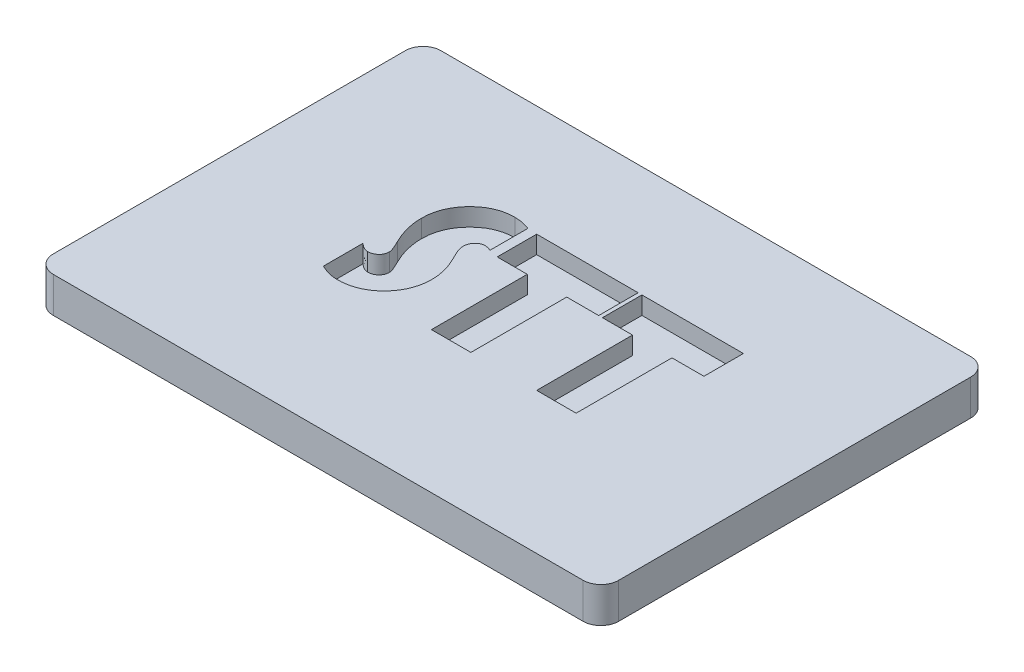
from build123d import *

# Parameters (mm, degrees)
SKETCH1_W           = 31.8
SKETCH1_H           = 21.8
BOSS_EXTRUDE1_DEPTH = 2
FILLET1_R           = 1
CUT_EXTRUDE1_DEPTH  = 1


with BuildPart() as part:
    # Sketch1 → Boss-Extrude1 (new body)
    with BuildSketch(Plane(origin=(0, 0, 0), x_dir=(1, 0, 0), z_dir=(0, 1, 0))):
        with Locations((15.9, 10.9)):
            Rectangle(SKETCH1_W, SKETCH1_H)
    extrude(amount=BOSS_EXTRUDE1_DEPTH)

    # Fillet1
    fillet1_edges = [part.edges().sort_by_distance(p)[0] for p in [
        (0, 1, -21.8),
        (31.8, 1, -21.8),
        (31.8, 1, 0),
        (0, 1, 0),
    ]]
    fillet(fillet1_edges, radius=FILLET1_R)

    # Sketch2 → Cut-Extrude1 (cut)
    with BuildSketch(Plane(origin=(0, 2, 0), x_dir=(1, 0, 0), z_dir=(0, 1, 0))):
        with BuildLine():
            Line((12.103669389, 15.588212785), (12.103669389, 13.462510817))
            add(Edge.make_bspline(
                [(12.103669389, 13.462510817), (12.067478164, 13.475119517), (11.999485838, 13.498807438), (11.902825223, 13.524429421), (11.819220361, 13.543594224), (11.767361344, 13.545755856), (11.743604875, 13.546746093)],
                knots=[0, 0, 0, 0, 1.237925225, 2.325685716, 3.233001373, 4, 4, 4, 4], degree=3))
            add(Edge.make_bspline(
                [(11.743604875, 13.546746093), (11.704213128, 13.544747386), (11.626409193, 13.540799674), (11.515264032, 13.5023983), (11.413284829, 13.440703726), (11.322657643, 13.357416549), (11.246986203, 13.257257504), (11.191005288, 13.144920434), (11.159374222, 13.021555746), (11.154701285, 12.936352871), (11.15230627, 12.892683949)],
                knots=[0, 0, 0, 0, 0.963368211, 1.902780206, 2.847611186, 3.870376157, 4.902016381, 5.910508887, 6.929075774, 8, 8, 8, 8], degree=3))
            add(Edge.make_bspline(
                [(11.15230627, 12.892683949), (11.15494117, 12.85121414), (11.160596524, 12.762206396), (11.196833346, 12.622832478), (11.251552483, 12.467862827), (11.302052911, 12.362588312), (11.329035183, 12.306340361)],
                knots=[0, 0, 0, 0, 0.806548219, 1.731115713, 2.787739919, 4, 4, 4, 4], degree=3))
            Line((11.329035183, 12.306340361), (11.480989014, 12.002432698))
            add(Edge.make_bspline(
                [(11.480989014, 12.002432698), (11.513536687, 11.934444257), (11.577742801, 11.800324882), (11.662079456, 11.597114589), (11.733408397, 11.395368804), (11.791392984, 11.195204542), (11.836455238, 10.996679116), (11.867058786, 10.800156819), (11.888566792, 10.605590355), (11.891027745, 10.476344982), (11.892255362, 10.411872484)],
                knots=[0, 0, 0, 0, 1.091274604, 2.152734579, 3.183918567, 4.18803247, 5.168547751, 6.129191744, 7.06676982, 8, 8, 8, 8], degree=3))
            add(Edge.make_bspline(
                [(11.892255362, 10.411872484), (11.890225491, 10.319811484), (11.886234258, 10.138796556), (11.848968389, 9.87257458), (11.7871313, 9.618136518), (11.705779366, 9.372853513), (11.594665045, 9.140936753), (11.462303763, 8.918016389), (11.304584517, 8.706541227), (11.12575761, 8.508278481), (10.930218444, 8.327288301), (10.721786317, 8.167515195), (10.501561069, 8.03381528), (10.271033103, 7.923175105), (10.030138854, 7.837614737), (9.778422655, 7.776154585), (9.516075498, 7.738855663), (9.337242235, 7.734881747), (9.246276689, 7.732860369)],
                knots=[0, 0, 0, 0, 1.053025029, 2.070510305, 3.068320851, 4.046527558, 5.021625387, 6.004830255, 7.00906403, 8.035056499, 9.055988148, 10.053937905, 11.035000932, 11.998716703, 12.975116181, 13.954559623, 14.959563797, 16, 16, 16, 16], degree=3))
            add(Edge.make_bspline(
                [(9.246276689, 7.732860369), (9.15737082, 7.735867692), (8.979182335, 7.741895083), (8.713145876, 7.796831496), (8.448152575, 7.881331106), (8.278615751, 7.963601867), (8.192509902, 8.005386262)],
                knots=[0, 0, 0, 0, 0.970033745, 1.944178097, 2.955871129, 4, 4, 4, 4], degree=3))
            Line((8.192509902, 8.005386262), (8.192509902, 10.225233539))
            add(Edge.make_bspline(
                [(8.192509902, 10.225233539), (8.239360411, 10.184176873), (8.326844527, 10.107511621), (8.464042527, 10.021318896), (8.593353454, 9.963617797), (8.679277497, 9.956180114), (8.719393295, 9.952707646)],
                knots=[0, 0, 0, 0, 1.232278927, 2.301038614, 3.206797186, 4, 4, 4, 4], degree=3))
            add(Edge.make_bspline(
                [(8.719393295, 9.952707646), (8.763072091, 9.9550561), (8.847761486, 9.959609549), (8.970006261, 9.99147408), (9.079760325, 10.046708338), (9.176034752, 10.12153861), (9.256059824, 10.212425828), (9.314481099, 10.317019556), (9.348992402, 10.433983951), (9.353137752, 10.515141043), (9.355287046, 10.557219627)],
                knots=[0, 0, 0, 0, 1.069499973, 2.073667633, 3.068739384, 4.058680921, 5.043096131, 6.014962219, 6.970791368, 8, 8, 8, 8], degree=3))
            add(Edge.make_bspline(
                [(9.355287046, 10.557219627), (9.353993911, 10.5732392), (9.35102175, 10.61005883), (9.336318039, 10.671177476), (9.315251067, 10.745339397), (9.283376584, 10.831283487), (9.24041635, 10.92869113), (9.194107325, 11.041092621), (9.135695208, 11.164785236), (9.092335481, 11.250480108), (9.069547776, 11.295517047)],
                knots=[0, 0, 0, 0, 0.484238432, 1.112981033, 1.890960445, 2.8104886, 3.874776843, 5.102625601, 6.477284912, 8, 8, 8, 8], degree=3))
            add(Edge.make_bspline(
                [(9.069547776, 11.295517047), (9.033489259, 11.370577397), (8.962137311, 11.519105476), (8.870718297, 11.74559598), (8.789324611, 11.970644468), (8.727749512, 12.197526783), (8.677743114, 12.424035557), (8.641289959, 12.650053805), (8.618764973, 12.876254743), (8.616481513, 13.026968628), (8.615337954, 13.102446303)],
                knots=[0, 0, 0, 0, 1.062729974, 2.102911069, 3.116516653, 4.11571732, 5.10138035, 6.076564273, 7.036741329, 8, 8, 8, 8], degree=3))
            add(Edge.make_bspline(
                [(8.615337954, 13.102446303), (8.617374488, 13.191763492), (8.621402125, 13.368405389), (8.658949616, 13.627812323), (8.718714197, 13.877686492), (8.800892673, 14.118407163), (8.909835089, 14.348957713), (9.039927599, 14.570795718), (9.195510347, 14.78216903), (9.372301671, 14.981267002), (9.564876472, 15.164537181), (9.768891596, 15.326311523), (9.983003732, 15.462709256), (10.206808123, 15.57362623), (10.439734455, 15.660677849), (10.682504581, 15.720848377), (10.934047885, 15.761052579), (11.105351026, 15.764732921), (11.1919464, 15.76659337)],
                knots=[0, 0, 0, 0, 1.04134106, 2.059451963, 3.050112589, 4.035116009, 5.020558971, 6.01953182, 7.030426816, 8.076805362, 9.121606136, 10.127593448, 11.109241514, 12.077117541, 13.036218445, 14.003476409, 14.990738247, 16, 16, 16, 16], degree=3))
            add(Edge.make_bspline(
                [(11.1919464, 15.76659337), (11.26913802, 15.764225264), (11.423662557, 15.759484719), (11.65386646, 15.725511903), (11.881797356, 15.669538692), (12.029240242, 15.615494357), (12.103669389, 15.588212785)],
                knots=[0, 0, 0, 0, 0.991240117, 1.984294677, 2.982472252, 4, 4, 4, 4], degree=3))
        make_face()
        Polygon((16.543363942, 13.335332067), (16.543363942, 7.944274395), (14.323516665, 7.944274395), (14.323516665, 13.335332067), (12.632204454, 13.335332067), (12.632204454, 15.555179343), (18.340383165, 15.555179343), (18.340383165, 13.335332067), align=None)
        Polygon((22.462956679, 13.335332067), (22.462956679, 7.944274395), (20.243109402, 7.944274395), (20.243109402, 13.335332067), (18.551797192, 13.335332067), (18.551797192, 15.555179343), (24.259975903, 15.555179343), (24.259975903, 13.335332067), align=None)
    extrude(amount=-CUT_EXTRUDE1_DEPTH, mode=Mode.SUBTRACT)


solid = part.part
